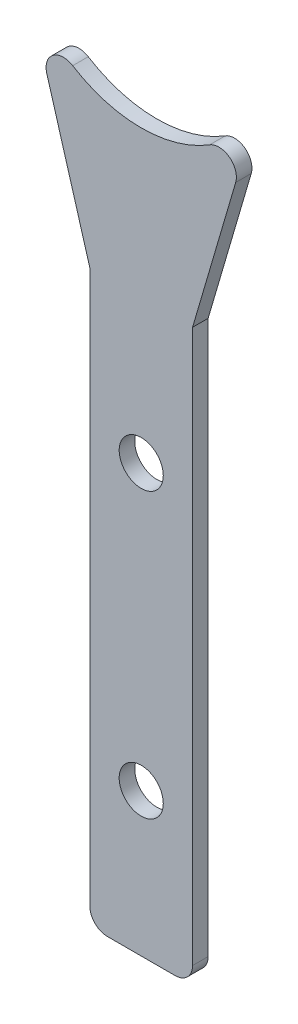
from build123d import *

# Parameters (mm, degrees)
SKETCH1_R            = 2
BOSS_EXTRUDE1_DEPTH  = 1.5875
FILLET2_R            = 1.778
M4_CLEARANCE_HOLE2_D = 4.5


with BuildPart() as part:
    # Sketch1 → Boss-Extrude1 (new body)
    with BuildSketch(Plane.XY):
        with BuildLine():
            Line((-3.078924099, -28.617866551), (2.159951047, -28.617866551))
            Line((2.159951047, -28.617866551), (7.399260817, -28.617866551))
            Line((7.399260817, -28.617866551), (7.399260817, 14.567438128))
            Line((7.399260817, 14.567438128), (7.399260817, 29.567438098))
            Line((7.399260817, 29.567438098), (13.897648784, 51.719401208))
            ThreePointArc((13.897648784, 51.719401208), (2.158996515, 44.568125735), (-9.579655755, 51.719401208))
            Line((-9.579655755, 51.719401208), (-3.078924099, 29.568125765))
            Line((-3.078924099, 29.568125765), (-3.078924099, -28.617866551))
        make_face()
        with BuildLine():
            ThreePointArc((4.159951047, -14.006866551), (3.574164609, -15.421080114), (2.159951047, -16.006866551))
            ThreePointArc((2.159951047, -16.006866551), (0.745737485, -12.592652989), (4.159951047, -14.006866551))
        make_face(mode=Mode.SUBTRACT)
        with Locations((2.159951047, 14.957125769)):
            Circle(SKETCH1_R, mode=Mode.SUBTRACT)
    extrude(amount=BOSS_EXTRUDE1_DEPTH)

    # Fillet2
    fillet2_edges = [part.edges().sort_by_distance(p)[0] for p in [
        (7.399260817, -28.617866551, 0.79375),
        (-3.078924099, -28.617866551, 0.79375),
        (-9.579655755, 51.719401208, 0.79375),
        (13.897648784, 51.719401208, 0.79375),
    ]]
    fillet(fillet2_edges, radius=FILLET2_R)

    # M4 Clearance Hole2 (through all)
    with Locations(Plane.XY.offset(1.5875)):
        with Locations((2.159951047, 14.957125769), (2.159951047, -14.006866551)):
            Hole(M4_CLEARANCE_HOLE2_D / 2)


solid = part.part
